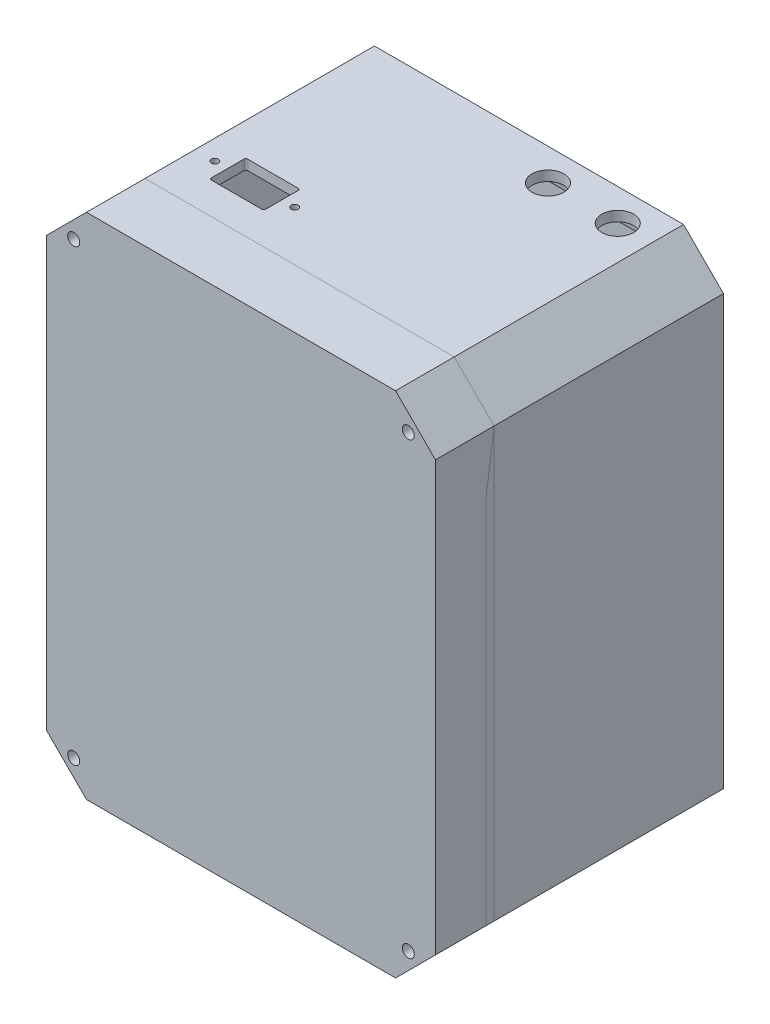
from build123d import *

# Parameters (mm, degrees)
SKETCH1_R               = 2.1
BOSS_EXTRUDE2_DEPTH     = 115
SHELL1_T                = -5
SKETCH9_W               = 64.25
SKETCH9_H               = 100
BOSS_EXTRUDE3_DEPTH     = 2
SKETCH10_W              = 64.25
SKETCH10_H              = 100
BOSS_EXTRUDE4_DEPTH     = 1
CUT_EXTRUDE1_DEPTH      = 195.582887223
CUT_EXTRUDE1_DEPTH_BACK = 195.582887223
SKETCH2_R               = 2.75
SKETCH3_W               = 30
SKETCH3_H               = 65
CUT_EXTRUDE2_DEPTH      = 5
CUT_EXTRUDE3_REACH      = 298.237
SKETCH4_R               = 8
CHAMFER2_SIZE           = 5
CUT_EXTRUDE4_REACH      = 298.237
SKETCH5_R               = 1.75
SKETCH6_W               = 35
SKETCH6_H               = 245
CUT_EXTRUDE5_DEPTH      = 195.582887223
CUT_EXTRUDE6_REACH      = 293.944
SKETCH11_R              = 2.75
BOSS_EXTRUDE5_DEPTH     = 4
BOSS_EXTRUDE6_START     = 5
BOSS_EXTRUDE6_DEPTH     = 5
BOSS_EXTRUDE7_DEPTH     = 4
SKETCH13_4_R            = 3
BOSS_EXTRUDE8_DEPTH     = 25.4
SKETCH14_R              = 3
BOSS_EXTRUDE9_DEPTH     = 4


with BuildPart() as part:
    # Sketch1 → Boss-Extrude2 (new body)
    with BuildSketch(Plane(origin=(0, 0, 0), x_dir=(0, 1, 0), z_dir=(0, 0, 1))):
        Polygon((-107.5, 97.5), (107.5, 97.5), (127.5, 77.5), (127.5, -77.5), (107.5, -97.5), (-107.5, -97.5), (-127.5, -77.5), (-127.5, 77.5), align=None)
        with Locations(Location((-112.636485066, 83.87823356, 0), (0, 0, 270))):
            Circle(SKETCH1_R, mode=Mode.SUBTRACT)
        with Locations(Location((112.636485066, 83.87823356, 0), (0, 0, 270))):
            Circle(SKETCH1_R, mode=Mode.SUBTRACT)
        with Locations(Location((112.636485066, -83.87823356, 0), (0, 0, 270))):
            Circle(SKETCH1_R, mode=Mode.SUBTRACT)
        with Locations(Location((-112.636485066, -83.87823356, 0), (0, 0, 270))):
            Circle(SKETCH1_R, mode=Mode.SUBTRACT)
    extrude(amount=BOSS_EXTRUDE2_DEPTH)

    # Shell1
    shell1_openings = [part.faces().sort_by_distance(p)[0] for p in [
        (0, 0, 115),
    ]]
    offset(amount=SHELL1_T, openings=shell1_openings)

    # Sketch9 → Boss-Extrude3 (add)
    with BuildSketch(Plane.XY.offset(5)):
        with Locations((43, -72.5)):
            Rectangle(SKETCH9_W, SKETCH9_H)
    extrude(amount=BOSS_EXTRUDE3_DEPTH)

    # Sketch10 → Boss-Extrude4 (add)
    with BuildSketch(Plane.XY.offset(5)):
        with Locations((43, 27.5)):
            Rectangle(SKETCH10_W, SKETCH10_H)
    extrude(amount=BOSS_EXTRUDE4_DEPTH)

    # Sketch2 → Cut-Extrude1 (cut, two sides: drawn at the far end of the back side and taken through both)
    with BuildSketch(Plane.XY.offset(5).offset(-CUT_EXTRUDE1_DEPTH_BACK)):
        with Locations((53.875, -67.5)):
            Circle(SKETCH2_R)
        with Locations((67.125, -67.5)):
            Circle(SKETCH2_R)
        with Locations((32.125, -107.5)):
            Circle(SKETCH2_R)
        with Locations((18.875, -107.5)):
            Circle(SKETCH2_R)
        with Locations((-44.5, 114.5)):
            Circle(SKETCH2_R)
        with Locations((-44.5, -114.5)):
            Circle(SKETCH2_R)
    extrude(amount=CUT_EXTRUDE1_DEPTH + CUT_EXTRUDE1_DEPTH_BACK, mode=Mode.SUBTRACT)

    # Sketch3 → Cut-Extrude2 (cut)
    with BuildSketch(Plane.XZ.offset(127.5)):
        with Locations((25.5, 32.5)):
            Rectangle(SKETCH3_W, SKETCH3_H)
        with Locations((60.5, 32.5)):
            Rectangle(SKETCH3_W, SKETCH3_H)
    extrude(amount=-CUT_EXTRUDE2_DEPTH, mode=Mode.SUBTRACT)

    # Sketch4 → Cut-Extrude3 (cut, up to next)
    with BuildSketch(Plane(origin=(0, 127.5, 0), x_dir=(-1, 0, 0), z_dir=(0, 1, 0)), mode=Mode.PRIVATE) as cut_extrude3_sk1:
        with Locations(Location((-60.5, 16, 0), (0, 0, 90))):
            Circle(SKETCH4_R)
    cut_extrude3_tool1 = extrude(cut_extrude3_sk1.sketch, amount=-CUT_EXTRUDE3_REACH, mode=Mode.PRIVATE) & part.part
    # Sketch4 → Cut-Extrude3 (cut, up to next)
    with BuildSketch(Plane(origin=(0, 127.5, 0), x_dir=(-1, 0, 0), z_dir=(0, 1, 0)), mode=Mode.PRIVATE) as cut_extrude3_sk2:
        with Locations(Location((-25.5, 16, 0), (0, 0, 90))):
            Circle(SKETCH4_R)
    cut_extrude3_tool2 = extrude(cut_extrude3_sk2.sketch, amount=-CUT_EXTRUDE3_REACH, mode=Mode.PRIVATE) & part.part
    add(cut_extrude3_tool1.solids().sort_by_distance((60.5, 127.5, 16))[0], mode=Mode.SUBTRACT)
    add(cut_extrude3_tool2.solids().sort_by_distance((25.5, 127.5, 16))[0], mode=Mode.SUBTRACT)

    # Chamfer2
    # the kernel refuses this chamfer: 5 mm, written as the material it adds along each edge
    with BuildSketch(Plane(origin=(-88.287347128, -122.5, 5), x_dir=(0, -0.0274958766105877, 0.9996219169112968), z_dir=(1, 0, 0))) as chamfer2_piece_1_section:
        Polygon((CHAMFER2_SIZE * 0.999621916911, -CHAMFER2_SIZE * 0.0274958766106), (-CHAMFER2_SIZE * 0.0274958766106, -CHAMFER2_SIZE * 0.999621916911), (0, 0), align=None)
    chamfer2_piece_1 = extrude(amount=98.787347128, mode=Mode.PRIVATE)
    chamfer2_piece_1 = split(chamfer2_piece_1, bisect_by=Plane(origin=(-54.70101301, -143.227919178, 7.997124088), z_dir=(0.7071067811865479, 0.7071067811865474, 0)), keep=Keep.TOP, mode=Mode.PRIVATE)
    add(chamfer2_piece_1)
    with BuildSketch(Plane(origin=(92.5, -118.287347128, 5), x_dir=(0.0274958766105877, 0, 0.9996219169112968), z_dir=(0, 1, 0))) as chamfer2_piece_2_section:
        Polygon((CHAMFER2_SIZE * 0.999621916911, -CHAMFER2_SIZE * 0.0274958766106), (-CHAMFER2_SIZE * 0.0274958766106, -CHAMFER2_SIZE * 0.999621916911), (0, 0), align=None)
    chamfer2_piece_2 = extrude(amount=236.574694256, mode=Mode.PRIVATE)
    chamfer2_piece_2 = split(chamfer2_piece_2, bisect_by=Plane(origin=(144.377210147, -53.551722042, 6.662744025), z_dir=(-0.7071067811865472, 0.7071067811865478, 0)), keep=Keep.TOP, mode=Mode.PRIVATE)
    chamfer2_piece_2 = split(chamfer2_piece_2, bisect_by=Plane(origin=(144.377210092, 53.551722096, 6.662744025), z_dir=(-0.7071067811865476, -0.7071067811865476, 0)), keep=Keep.TOP, mode=Mode.PRIVATE)
    add(chamfer2_piece_2)
    with BuildSketch(Plane(origin=(88.287347128, 122.5, 5), x_dir=(0, 0.0274958766105877, 0.9996219169112968), z_dir=(-1, 0, 0))) as chamfer2_piece_3_section:
        Polygon((CHAMFER2_SIZE * 0.999621916911, -CHAMFER2_SIZE * 0.0274958766106), (-CHAMFER2_SIZE * 0.0274958766106, -CHAMFER2_SIZE * 0.999621916911), (0, 0), align=None)
    chamfer2_piece_3 = extrude(amount=176.574694256, mode=Mode.PRIVATE)
    chamfer2_piece_3 = split(chamfer2_piece_3, bisect_by=Plane(origin=(38.298167752, 159.630764436, 6.630923674), z_dir=(-0.7071067811865476, -0.7071067811865476, 0)), keep=Keep.TOP, mode=Mode.PRIVATE)
    chamfer2_piece_3 = split(chamfer2_piece_3, bisect_by=Plane(origin=(-38.828524729, 159.100407459, 6.630923674), z_dir=(0.7071067811865468, -0.7071067811865482, 0)), keep=Keep.TOP, mode=Mode.PRIVATE)
    chamfer2_piece_3 = chamfer2_piece_3 - Plane(origin=(25.5, 120.802239706, 16), x_dir=(0, 0, 1), z_dir=(0, 1, 0)) * Cylinder(8, 374, mode=Mode.PRIVATE)
    chamfer2_piece_3 = chamfer2_piece_3 - Plane(origin=(60.5, 120.802239706, 16), x_dir=(0, 0, 1), z_dir=(0, 1, 0)) * Cylinder(8, 374, mode=Mode.PRIVATE)
    add(chamfer2_piece_3)
    with BuildSketch(Plane(origin=(-92.5, 118.287347128, 5), x_dir=(-0.0274958766105877, 0, 0.9996219169112968), z_dir=(0, -1, 0))) as chamfer2_piece_4_section:
        Polygon((CHAMFER2_SIZE * 0.999621916911, -CHAMFER2_SIZE * 0.0274958766106), (-CHAMFER2_SIZE * 0.0274958766106, -CHAMFER2_SIZE * 0.999621916911), (0, 0), align=None)
    chamfer2_piece_4 = extrude(amount=236.574694256, mode=Mode.PRIVATE)
    chamfer2_piece_4 = split(chamfer2_piece_4, bisect_by=Plane(origin=(-144.377210147, 53.551722042, 6.662744025), z_dir=(0.7071067811865468, -0.7071067811865482, 0)), keep=Keep.TOP, mode=Mode.PRIVATE)
    chamfer2_piece_4 = split(chamfer2_piece_4, bisect_by=Plane(origin=(-144.377210092, -53.551722096, 6.662744025), z_dir=(0.7071067811865479, 0.7071067811865474, 0)), keep=Keep.TOP, mode=Mode.PRIVATE)
    add(chamfer2_piece_4)

    # Sketch5 → Cut-Extrude4 (cut, up to next)
    with BuildSketch(Plane(origin=(0, 127.5, 0), x_dir=(-1, 0, 0), z_dir=(0, 1, 0)), mode=Mode.PRIVATE) as cut_extrude4_sk1:
        with Locations((27.5, 90)):
            Circle(SKETCH5_R)
    cut_extrude4_tool1 = extrude(cut_extrude4_sk1.sketch, amount=-CUT_EXTRUDE4_REACH, mode=Mode.PRIVATE) & part.part
    # Sketch5 → Cut-Extrude4 (cut, up to next)
    with BuildSketch(Plane(origin=(0, 127.5, 0), x_dir=(-1, 0, 0), z_dir=(0, 1, 0)), mode=Mode.PRIVATE) as cut_extrude4_sk2:
        with Locations((67.5, 90)):
            Circle(SKETCH5_R)
    cut_extrude4_tool2 = extrude(cut_extrude4_sk2.sketch, amount=-CUT_EXTRUDE4_REACH, mode=Mode.PRIVATE) & part.part
    # Sketch5 → Cut-Extrude4 (cut, up to next)
    with BuildSketch(Plane(origin=(0, 127.5, 0), x_dir=(-1, 0, 0), z_dir=(0, 1, 0)), mode=Mode.PRIVATE) as cut_extrude4_sk3:
        with BuildLine():
            Line((34.9, 99.1), (60.1, 99.1))
            ThreePointArc((60.1, 99.1), (60.807106781, 98.807106781), (61.1, 98.1))
            Line((61.1, 98.1), (61.1, 81.9))
            ThreePointArc((61.1, 81.9), (60.807106781, 81.192893219), (60.1, 80.9))
            Line((60.1, 80.9), (34.9, 80.9))
            ThreePointArc((34.9, 80.9), (34.192893219, 81.192893219), (33.9, 81.9))
            Line((33.9, 81.9), (33.9, 98.1))
            ThreePointArc((33.9, 98.1), (34.192893219, 98.807106781), (34.9, 99.1))
        make_face()
    cut_extrude4_tool3 = extrude(cut_extrude4_sk3.sketch, amount=-CUT_EXTRUDE4_REACH, mode=Mode.PRIVATE) & part.part
    add(cut_extrude4_tool1.solids().sort_by_distance((-27.5, 127.5, 90))[0], mode=Mode.SUBTRACT)
    add(cut_extrude4_tool2.solids().sort_by_distance((-67.5, 127.5, 90))[0], mode=Mode.SUBTRACT)
    add(cut_extrude4_tool3.solids().sort_by_distance((-47.5, 127.5, 90))[0], mode=Mode.SUBTRACT)

    # Sketch6 → Cut-Extrude5 (cut, through all)
    with BuildSketch(Plane.XY.offset(5)):
        with Locations((-44.5, 0)):
            Rectangle(SKETCH6_W, SKETCH6_H)
    extrude(amount=CUT_EXTRUDE5_DEPTH, mode=Mode.SUBTRACT)

    # Sketch7 → Cut-Extrude6 (cut, up to next)
    with BuildSketch(Plane.XZ.offset(-122.5), mode=Mode.PRIVATE) as cut_extrude6_sk1:
        Polygon((25.5, 5), (35.026279442, 10.5), (35.026279442, 21.5), (25.5, 27), (15.973720558, 21.5), (15.973720558, 10.5), align=None)
    cut_extrude6_tool1 = extrude(cut_extrude6_sk1.sketch, amount=CUT_EXTRUDE6_REACH, mode=Mode.PRIVATE) & part.part
    # Sketch7 → Cut-Extrude6 (cut, up to next)
    with BuildSketch(Plane.XZ.offset(-122.5), mode=Mode.PRIVATE) as cut_extrude6_sk2:
        Polygon((60.5, 5), (70.026279442, 10.5), (70.026279442, 21.5), (60.5, 27), (50.973720558, 21.5), (50.973720558, 10.5), align=None)
    cut_extrude6_tool2 = extrude(cut_extrude6_sk2.sketch, amount=CUT_EXTRUDE6_REACH, mode=Mode.PRIVATE) & part.part
    add(cut_extrude6_tool1.solids().sort_by_distance((25.5, 122.5, 16))[0], mode=Mode.SUBTRACT)
    add(cut_extrude6_tool2.solids().sort_by_distance((60.5, 122.5, 16))[0], mode=Mode.SUBTRACT)


with BuildPart() as body_2:
    # Sketch11 → Boss-Extrude5 (new body)
    with BuildSketch(Plane.XY.offset(115)):
        Polygon((-97.5, -107.5), (-77.5, -127.5), (77.5, -127.5), (97.5, -107.5), (97.5, 107.5), (77.5, 127.5), (-77.5, 127.5), (-97.5, 107.5), align=None)
        with Locations((83.87823356, 112.636485066)):
            Circle(SKETCH11_R, mode=Mode.SUBTRACT)
        with Locations((83.87823356, -112.636485066)):
            Circle(SKETCH11_R, mode=Mode.SUBTRACT)
        with Locations((-83.87823356, -112.636485066)):
            Circle(SKETCH11_R, mode=Mode.SUBTRACT)
        with Locations((-83.87823356, 112.636485066)):
            Circle(SKETCH11_R, mode=Mode.SUBTRACT)
    extrude(amount=BOSS_EXTRUDE5_DEPTH)

    # Sketch12 → Boss-Extrude6 (add)
    with BuildSketch(Plane(origin=(0, 0, 115), x_dir=(1, 0, 0), z_dir=(0, 0, -1)).offset(BOSS_EXTRUDE6_START)):
        with BuildLine():
            Line((-89.555752799, 108.373179389), (-92.5, 105.428932188))
            Line((-92.5, 105.428932188), (-92.5, -105.428932188))
            Line((-92.5, -105.428932188), (-89.555752799, -108.373179389))
            ThreePointArc((-89.555752799, -108.373179389), (-78.857775413, -107.61602692), (-79.614927883, -118.314004305))
            Line((-79.614927883, -118.314004305), (-75.428932188, -122.5))
            Line((-75.428932188, -122.5), (75.428932188, -122.5))
            Line((75.428932188, -122.5), (79.614927883, -118.314004305))
            ThreePointArc((79.614927883, -118.314004305), (78.857775413, -107.61602692), (89.555752799, -108.373179389))
            Line((89.555752799, -108.373179389), (92.5, -105.428932188))
            Line((92.5, -105.428932188), (92.5, 105.428932188))
            Line((92.5, 105.428932188), (89.555752799, 108.373179389))
            ThreePointArc((89.555752799, 108.373179389), (78.857775413, 107.61602692), (79.614927883, 118.314004305))
            Line((79.614927883, 118.314004305), (75.428932188, 122.5))
            Line((75.428932188, 122.5), (-75.428932188, 122.5))
            Line((-75.428932188, 122.5), (-79.614927883, 118.314004305))
            ThreePointArc((-79.614927883, 118.314004305), (-78.857775413, 107.61602692), (-89.555752799, 108.373179389))
        make_face()
        with BuildLine():
            Line((-88.5, 102.544444887), (-88.5, -102.544444887))
            ThreePointArc((-88.5, -102.544444887), (-75.713217167, -105.117009865), (-74.200128186, -118.071949753))
            Line((-74.200128186, -118.071949753), (-73.772077939, -118.5))
            Line((-73.772077939, -118.5), (73.772077939, -118.5))
            Line((73.772077939, -118.5), (74.200128186, -118.071949753))
            ThreePointArc((74.200128186, -118.071949753), (75.713217167, -105.117009865), (88.5, -102.544444887))
            Line((88.5, -102.544444887), (88.5, 102.544444887))
            ThreePointArc((88.5, 102.544444887), (75.713217167, 105.117009865), (74.200128186, 118.071949753))
            Line((74.200128186, 118.071949753), (73.772077939, 118.5))
            Line((73.772077939, 118.5), (-73.772077939, 118.5))
            Line((-73.772077939, 118.5), (-74.200128186, 118.071949753))
            ThreePointArc((-74.200128186, 118.071949753), (-75.713217167, 105.117009865), (-88.5, 102.544444887))
        make_face(mode=Mode.SUBTRACT)
    extrude(amount=-BOSS_EXTRUDE6_DEPTH)


with BuildPart() as body_3:
    # Sketch13 → Boss-Extrude7 (new body)
    with BuildSketch(Plane.XY.offset(115)):
        with BuildLine():
            Line((-89.555752799, -108.373179389), (-92.5, -105.428932188))
            Line((-92.5, -105.428932188), (-92.5, 105.428932188))
            Line((-92.5, 105.428932188), (-89.555752799, 108.373179389))
            ThreePointArc((-89.555752799, 108.373179389), (-78.857775413, 107.61602692), (-79.614927883, 118.314004305))
            Line((-79.614927883, 118.314004305), (-75.428932188, 122.5))
            Line((-75.428932188, 122.5), (75.428932188, 122.5))
            Line((75.428932188, 122.5), (79.614927883, 118.314004305))
            ThreePointArc((79.614927883, 118.314004305), (78.857775413, 107.61602692), (89.555752799, 108.373179389))
            Line((89.555752799, 108.373179389), (92.5, 105.428932188))
            Line((92.5, 105.428932188), (92.5, -105.428932188))
            Line((92.5, -105.428932188), (89.555752799, -108.373179389))
            ThreePointArc((89.555752799, -108.373179389), (78.857775413, -107.61602692), (79.614927883, -118.314004305))
            Line((79.614927883, -118.314004305), (75.428932188, -122.5))
            Line((75.428932188, -122.5), (-75.428932188, -122.5))
            Line((-75.428932188, -122.5), (-79.614927883, -118.314004305))
            ThreePointArc((-79.614927883, -118.314004305), (-78.857775413, -107.61602692), (-89.555752799, -108.373179389))
        make_face()
        with BuildLine():
            Line((88.5, -102.544444887), (88.5, 102.544444887))
            ThreePointArc((88.5, 102.544444887), (75.713217167, 105.117009865), (74.200128186, 118.071949753))
            Line((74.200128186, 118.071949753), (73.772077939, 118.5))
            Line((73.772077939, 118.5), (-73.772077939, 118.5))
            Line((-73.772077939, 118.5), (-74.200128186, 118.071949753))
            ThreePointArc((-74.200128186, 118.071949753), (-75.713217167, 105.117009865), (-88.5, 102.544444887))
            Line((-88.5, 102.544444887), (-88.5, -102.544444887))
            ThreePointArc((-88.5, -102.544444887), (-75.713217167, -105.117009865), (-74.200128186, -118.071949753))
            Line((-74.200128186, -118.071949753), (-73.772077939, -118.5))
            Line((-73.772077939, -118.5), (73.772077939, -118.5))
            Line((73.772077939, -118.5), (74.200128186, -118.071949753))
            ThreePointArc((74.200128186, -118.071949753), (75.713217167, -105.117009865), (88.5, -102.544444887))
        make_face(mode=Mode.SUBTRACT)
    extrude(amount=-BOSS_EXTRUDE7_DEPTH)

    # Sketch13<4> → Boss-Extrude8 (add)
    # profile 1 of 2: a face of its own
    with BuildSketch(Plane.XY.offset(115)):
        Polygon((-97.5, 107.5), (-97.5, -107.5), (-77.5, -127.5), (77.5, -127.5), (97.5, -107.5), (97.5, 107.5), (77.5, 127.5), (-77.5, 127.5), align=None)
        with Locations((-83.87823356, 112.636485066)):
            Circle(SKETCH13_4_R, mode=Mode.SUBTRACT)
        with Locations((-83.87823356, -112.636485066)):
            Circle(SKETCH13_4_R, mode=Mode.SUBTRACT)
        with Locations((83.87823356, -112.636485066)):
            Circle(SKETCH13_4_R, mode=Mode.SUBTRACT)
        with Locations((83.87823356, 112.636485066)):
            Circle(SKETCH13_4_R, mode=Mode.SUBTRACT)
        with BuildLine():
            ThreePointArc((-79.614927883, -118.314004305), (-78.857775413, -107.61602692), (-89.555752799, -108.373179389))
            Line((-89.555752799, -108.373179389), (-92.5, -105.428932188))
            Line((-92.5, -105.428932188), (-92.5, 105.428932188))
            Line((-92.5, 105.428932188), (-89.555752799, 108.373179389))
            ThreePointArc((-89.555752799, 108.373179389), (-78.857775413, 107.61602692), (-79.614927883, 118.314004305))
            Line((-79.614927883, 118.314004305), (-75.428932188, 122.5))
            Line((-75.428932188, 122.5), (75.428932188, 122.5))
            Line((75.428932188, 122.5), (79.614927883, 118.314004305))
            ThreePointArc((79.614927883, 118.314004305), (78.857775413, 107.61602692), (89.555752799, 108.373179389))
            Line((89.555752799, 108.373179389), (92.5, 105.428932188))
            Line((92.5, 105.428932188), (92.5, -105.428932188))
            Line((92.5, -105.428932188), (89.555752799, -108.373179389))
            ThreePointArc((89.555752799, -108.373179389), (78.857775413, -107.61602692), (79.614927883, -118.314004305))
            Line((79.614927883, -118.314004305), (75.428932188, -122.5))
            Line((75.428932188, -122.5), (-75.428932188, -122.5))
            Line((-75.428932188, -122.5), (-79.614927883, -118.314004305))
        make_face(mode=Mode.SUBTRACT)
    # profile 2 of 2: a face of its own
    with BuildSketch(Plane.XY.offset(115)):
        with BuildLine():
            Line((-89.555752799, -108.373179389), (-92.5, -105.428932188))
            Line((-92.5, -105.428932188), (-92.5, 105.428932188))
            Line((-92.5, 105.428932188), (-89.555752799, 108.373179389))
            ThreePointArc((-89.555752799, 108.373179389), (-78.857775413, 107.61602692), (-79.614927883, 118.314004305))
            Line((-79.614927883, 118.314004305), (-75.428932188, 122.5))
            Line((-75.428932188, 122.5), (75.428932188, 122.5))
            Line((75.428932188, 122.5), (79.614927883, 118.314004305))
            ThreePointArc((79.614927883, 118.314004305), (78.857775413, 107.61602692), (89.555752799, 108.373179389))
            Line((89.555752799, 108.373179389), (92.5, 105.428932188))
            Line((92.5, 105.428932188), (92.5, -105.428932188))
            Line((92.5, -105.428932188), (89.555752799, -108.373179389))
            ThreePointArc((89.555752799, -108.373179389), (78.857775413, -107.61602692), (79.614927883, -118.314004305))
            Line((79.614927883, -118.314004305), (75.428932188, -122.5))
            Line((75.428932188, -122.5), (-75.428932188, -122.5))
            Line((-75.428932188, -122.5), (-79.614927883, -118.314004305))
            ThreePointArc((-79.614927883, -118.314004305), (-78.857775413, -107.61602692), (-89.555752799, -108.373179389))
        make_face()
        with BuildLine():
            Line((88.5, -102.544444887), (88.5, 102.544444887))
            ThreePointArc((88.5, 102.544444887), (75.713217167, 105.117009865), (74.200128186, 118.071949753))
            Line((74.200128186, 118.071949753), (73.772077939, 118.5))
            Line((73.772077939, 118.5), (-73.772077939, 118.5))
            Line((-73.772077939, 118.5), (-74.200128186, 118.071949753))
            ThreePointArc((-74.200128186, 118.071949753), (-75.713217167, 105.117009865), (-88.5, 102.544444887))
            Line((-88.5, 102.544444887), (-88.5, -102.544444887))
            ThreePointArc((-88.5, -102.544444887), (-75.713217167, -105.117009865), (-74.200128186, -118.071949753))
            Line((-74.200128186, -118.071949753), (-73.772077939, -118.5))
            Line((-73.772077939, -118.5), (73.772077939, -118.5))
            Line((73.772077939, -118.5), (74.200128186, -118.071949753))
            ThreePointArc((74.200128186, -118.071949753), (75.713217167, -105.117009865), (88.5, -102.544444887))
        make_face(mode=Mode.SUBTRACT)
    extrude(amount=BOSS_EXTRUDE8_DEPTH)

    # Sketch14 → Boss-Extrude9 (add)
    with BuildSketch(Plane.XY.offset(140.4)):
        Polygon((-97.5, 107.5), (-97.5, -107.5), (-77.5, -127.5), (77.5, -127.5), (97.5, -107.5), (97.5, 107.5), (77.5, 127.5), (-77.5, 127.5), align=None)
        with Locations((-83.87823356, 112.636485066)):
            Circle(SKETCH14_R, mode=Mode.SUBTRACT)
        with Locations((-83.87823356, -112.636485066)):
            Circle(SKETCH14_R, mode=Mode.SUBTRACT)
        with Locations((83.87823356, -112.636485066)):
            Circle(SKETCH14_R, mode=Mode.SUBTRACT)
        with Locations((83.87823356, 112.636485066)):
            Circle(SKETCH14_R, mode=Mode.SUBTRACT)
    extrude(amount=BOSS_EXTRUDE9_DEPTH)


solid = Compound([part.part, body_2.part, body_3.part])
